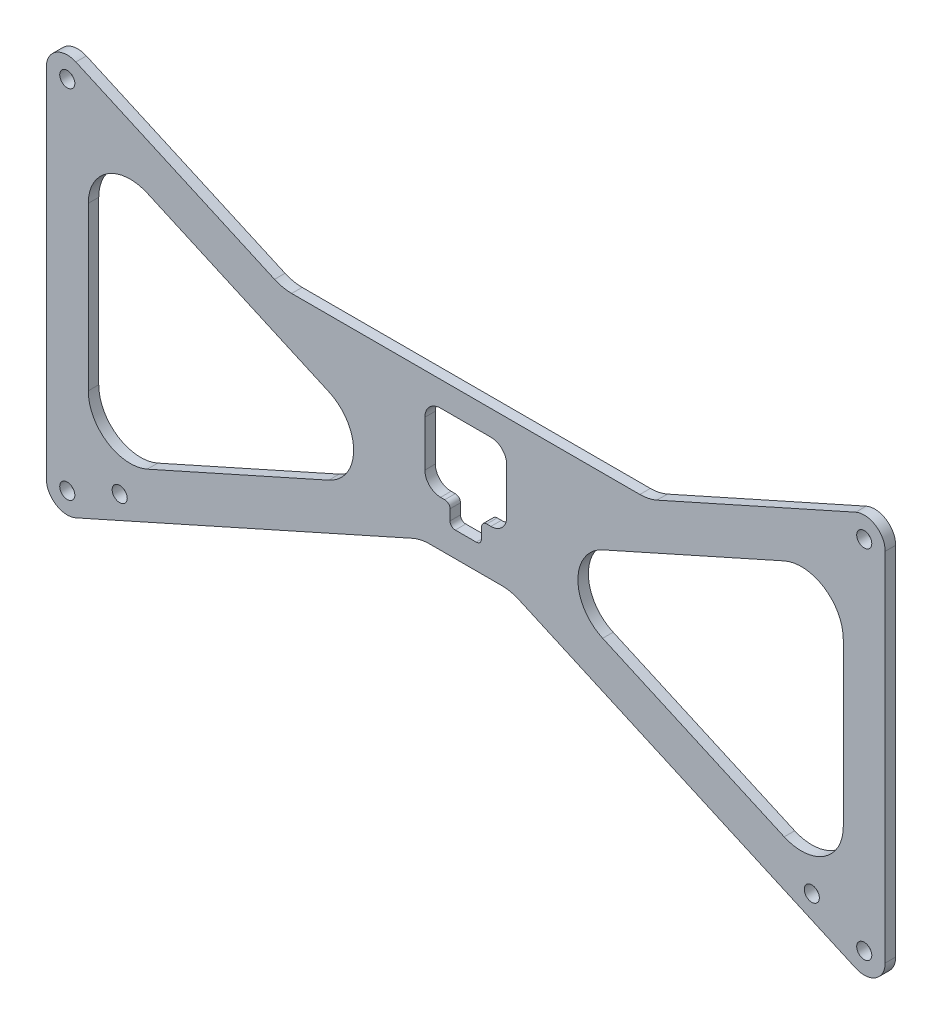
from build123d import *

# Parameters (mm, degrees)
BOSS_EXTRUDE1_DEPTH = 3.175
SKETCH2_R           = 2.286
CUT_EXTRUDE1_DEPTH  = 141.634939649
FILLET1_R           = 12.7
CUT_EXTRUDE2_DEPTH  = 141.634939649
FILLET2_R           = 1.5875
FILLET3_R           = 4.7625


with BuildPart() as part:
    # Sketch1 → Boss-Extrude1 (new body)
    with BuildSketch(Plane.XY):
        with BuildLine():
            Line((-118.056875519, -59.7713959), (-13.632338155, -13.0551555))
            Line((-13.632338155, -13.0551555), (13.632338155, -13.0551555))
            Line((13.632338155, -13.0551555), (118.056875519, -59.7713959))
            ThreePointArc((118.056875519, -59.7713959), (124.103705224, -59.303641499), (127, -53.975))
            Line((127, -53.975), (127, 53.975))
            ThreePointArc((127, 53.975), (124.103705224, 59.303641499), (118.056875519, 59.7713959))
            Line((118.056875519, 59.7713959), (55.420814096, 31.75))
            Line((55.420814096, 31.75), (-55.420814096, 31.75))
            Line((-55.420814096, 31.75), (-118.056875519, 59.7713959))
            ThreePointArc((-118.056875519, 59.7713959), (-124.103705224, 59.303641499), (-127, 53.975))
            Line((-127, 53.975), (-127, -53.975))
            ThreePointArc((-127, -53.975), (-124.103705224, -59.303641499), (-118.056875519, -59.7713959))
        make_face()
        Polygon((-114.3, -44.177732622), (-15.549774139, 0), (-114.3, 44.177732622), align=None, mode=Mode.SUBTRACT)
        Polygon((15.549774139, 0), (114.3, 44.177732622), (114.3, -44.177732622), align=None, mode=Mode.SUBTRACT)
    extrude(amount=BOSS_EXTRUDE1_DEPTH)

    # Sketch2 → Cut-Extrude1 (cut, through all)
    with BuildSketch(Plane.XY.offset(3.175)):
        with Locations((-120.65, 53.975)):
            Circle(SKETCH2_R)
        with Locations((-120.65, -53.975)):
            Circle(SKETCH2_R)
        with Locations((120.65, -53.975)):
            Circle(SKETCH2_R)
        with Locations((120.65, 53.975)):
            Circle(SKETCH2_R)
        with Locations((104.775, -46.873026316)):
            Circle(SKETCH2_R)
        with Locations((-104.775, -46.873026316)):
            Circle(SKETCH2_R)
    extrude(amount=-CUT_EXTRUDE1_DEPTH, mode=Mode.SUBTRACT)

    # Fillet1
    fillet1_edges = [part.edges().sort_by_distance(p)[0] for p in [
        (114.3, -44.177732622, 1.5875),
        (114.3, 44.177732622, 1.5875),
        (15.549774139, 0, 1.5875),
        (-114.3, -44.177732622, 1.5875),
        (-15.549774139, 0, 1.5875),
        (-114.3, 44.177732622, 1.5875),
        (-55.420814096, 31.75, 1.5875),
        (55.420814096, 31.75, 1.5875),
        (13.632338155, -13.0551555, 1.5875),
        (-13.632338155, -13.0551555, 1.5875),
    ]]
    fillet(fillet1_edges, radius=FILLET1_R)

    # Sketch3 → Cut-Extrude2 (cut, through all)
    with BuildSketch(Plane.XY.offset(3.175)):
        Polygon((-12.3825, 24.209375), (12.3825, 24.209375), (12.3825, 0.8334375), (4.7625, 0.8334375), (4.7625, -5.5165625), (-4.7625, -5.5165625), (-4.7625, 0.8334375), (-12.3825, 0.8334375), align=None)
    extrude(amount=-CUT_EXTRUDE2_DEPTH, mode=Mode.SUBTRACT)

    # Fillet2
    fillet2_edges = [part.edges().sort_by_distance(p)[0] for p in [
        (4.7625, -5.5165625, 1.5875),
        (-4.7625, -5.5165625, 1.5875),
        (4.7625, 0.8334375, 1.5875),
        (-4.7625, 0.8334375, 1.5875),
    ]]
    fillet(fillet2_edges, radius=FILLET2_R)

    # Fillet3
    fillet3_edges = [part.edges().sort_by_distance(p)[0] for p in [
        (12.3825, 0.8334375, 1.5875),
        (12.3825, 24.209375, 1.5875),
        (-12.3825, 0.8334375, 1.5875),
        (-12.3825, 24.209375, 1.5875),
    ]]
    fillet(fillet3_edges, radius=FILLET3_R)


solid = part.part
